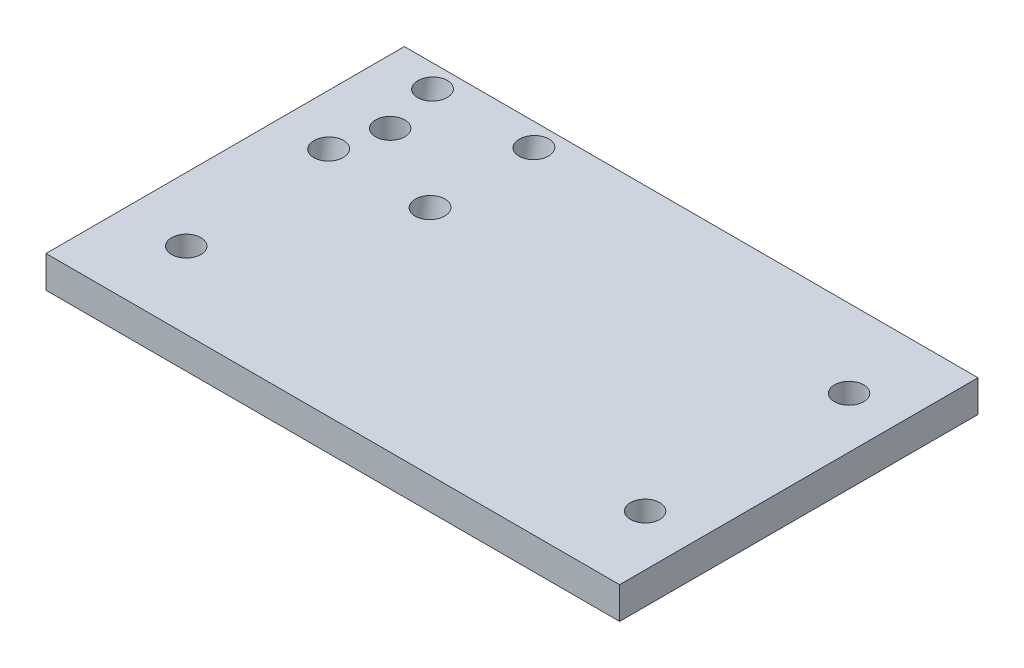
from build123d import *

# Parameters (mm, degrees)
SKETCH1_W           = 90
SKETCH1_H           = 56.23
BOSS_EXTRUDE1_DEPTH = 5
SKETCH2_R           = 2.3
CUT_EXTRUDE1_DEPTH  = 15
SKETCH7_R           = 2.3
CUT_EXTRUDE3_DEPTH  = 45
SKETCH10_R          = 2.3
CUT_EXTRUDE4_DEPTH  = 10


with BuildPart() as part:
    # Sketch1 → Boss-Extrude1 (new body)
    with BuildSketch(Plane(origin=(0, 0, 0), x_dir=(1, 0, 0), z_dir=(0, 1, 0))):
        with Locations((45, 28.115)):
            Rectangle(SKETCH1_W, SKETCH1_H)
    extrude(amount=BOSS_EXTRUDE1_DEPTH)

    # Sketch2 → Cut-Extrude1 (cut)
    with BuildSketch(Plane(origin=(0, 5, 0), x_dir=(1, 0, 0), z_dir=(0, 1, 0))):
        with Locations((82, 12)):
            Circle(SKETCH2_R)
        with Locations((10, 12)):
            Circle(SKETCH2_R)
    extrude(amount=-CUT_EXTRUDE1_DEPTH, mode=Mode.SUBTRACT)

    # Sketch7 → Cut-Extrude3 (cut)
    with BuildSketch(Plane(origin=(0, 5, 0), x_dir=(1, 0, 0), z_dir=(0, 1, 0))):
        with Locations((82, 44)):
            Circle(SKETCH7_R)
        with Locations((10, 44)):
            Circle(SKETCH7_R)
    extrude(amount=-CUT_EXTRUDE3_DEPTH, mode=Mode.SUBTRACT)

    # Sketch10 → Cut-Extrude4 (cut)
    with BuildSketch(Plane(origin=(0, 15.35002401, -2.983742412), x_dir=(-1, 0, 0), z_dir=(0, 0.9816271834476639, -0.19080899537654525))):
        with Locations((-7.980322592, -50.742851548)):
            Circle(SKETCH10_R)
        with Locations((-23.890464849, -50.742851548)):
            Circle(SKETCH10_R)
        with Locations((-7.980322592, -34.742851548)):
            Circle(SKETCH10_R)
        with Locations((-23.890464849, -34.742851548)):
            Circle(SKETCH10_R)
    extrude(amount=-CUT_EXTRUDE4_DEPTH, mode=Mode.SUBTRACT)


solid = part.part
